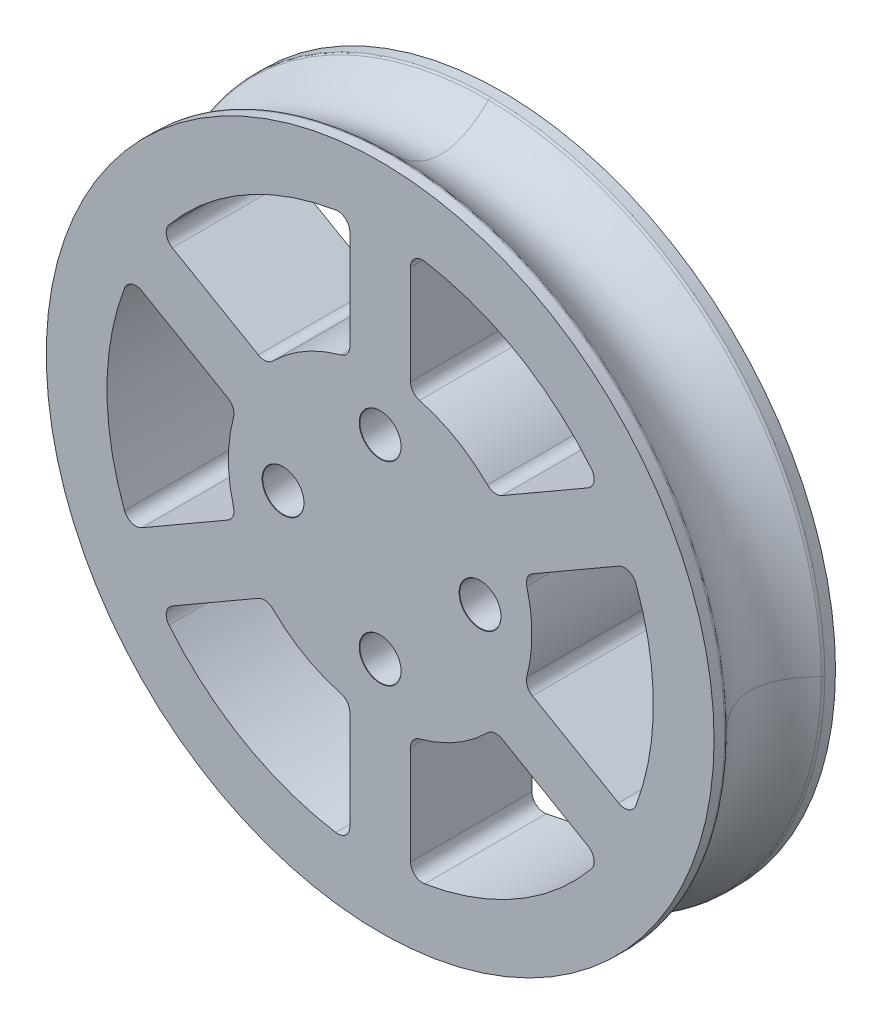
from build123d import *

# Parameters (mm, degrees)
SKETCH_1_R                  = 27.5
EXTRUDE_1_DEPTH             = 10
CUT_EXTRUDE_1_REACH         = 42.156
SKETCH_2_R                  = 22.5
SKETCH_3_R                  = 12.5
EXTRUDE_2_DEPTH             = 10
EXTRUDE_START               = 10
EXTRUDE_3_DEPTH             = 10
HOLE_WIZARD_M32_D           = 3.4
HOLE_WIZARD_M32_CSINK_D     = 3.45
HOLE_WIZARD_M32_CSINK_ANGLE = 90
FILLET_1_R                  = 1
FILLET_3_R                  = 0.3


with BuildPart() as part:
    # Эскиз1 → Бобышка-Вытянуть1 (new body)
    with BuildSketch(Plane.XY):
        Circle(SKETCH_1_R)
    extrude(amount=EXTRUDE_1_DEPTH)

    # Эскиз2 → Вырез-Вытянуть1 (cut, up to next)
    with BuildSketch(Plane.XY.offset(10), mode=Mode.PRIVATE) as cut_extrude_1_sk1:
        Circle(SKETCH_2_R)
    cut_extrude_1_tool1 = extrude(cut_extrude_1_sk1.sketch, amount=-CUT_EXTRUDE_1_REACH, mode=Mode.PRIVATE) & part.part
    add(cut_extrude_1_tool1.solids().sort_by_distance((0, 0, 10))[0], mode=Mode.SUBTRACT)



with BuildPart() as body_2:
    # Эскиз3 → Бобышка-Вытянуть2 (new body)
    with BuildSketch(Plane.XY):
        Circle(SKETCH_3_R)
    extrude(amount=EXTRUDE_2_DEPTH)


with BuildPart() as part_1:
    add(part.part)

    add(body_2.part)  # Бобышка-Вытянуть3 merges body 2
    # Эскиз5 → Бобышка-Вытянуть3 (add)
    with BuildSketch(Plane.XY.offset(EXTRUDE_START)):
        with BuildLine():
            Line((9.356601718, 8.288787866), (18.114916731, 13.345403397))
            ThreePointArc((18.114916731, 13.345403397), (19.485571585, 11.25), (20.614916731, 9.015276378))
            Line((20.614916731, 9.015276378), (11.856601718, 3.958660847))
            ThreePointArc((11.856601718, 3.958660847), (10.825317547, 6.25), (9.356601718, 8.288787866))
        make_face()
        with BuildLine():
            Line((2.5, 12.247448714), (2.5, 22.360679775))
            ThreePointArc((2.5, 22.360679775), (0, 22.5), (-2.5, 22.360679775))
            Line((-2.5, 22.360679775), (-2.5, 12.247448714))
            ThreePointArc((-2.5, 12.247448714), (0, 12.5), (2.5, 12.247448714))
        make_face()
        with BuildLine():
            Line((11.856601718, -3.958660847), (20.614916731, -9.015276378))
            ThreePointArc((20.614916731, -9.015276378), (19.485571585, -11.25), (18.114916731, -13.345403397))
            Line((18.114916731, -13.345403397), (9.356601718, -8.288787866))
            ThreePointArc((9.356601718, -8.288787866), (10.825317547, -6.25), (11.856601718, -3.958660847))
        make_face()
        with BuildLine():
            Line((2.5, -12.247448714), (2.5, -22.360679775))
            ThreePointArc((2.5, -22.360679775), (0, -22.5), (-2.5, -22.360679775))
            Line((-2.5, -22.360679775), (-2.5, -12.247448714))
            ThreePointArc((-2.5, -12.247448714), (0, -12.5), (2.5, -12.247448714))
        make_face()
        with BuildLine():
            Line((-9.356601718, -8.288787866), (-18.114916731, -13.345403397))
            ThreePointArc((-18.114916731, -13.345403397), (-19.485571585, -11.25), (-20.614916731, -9.015276378))
            Line((-20.614916731, -9.015276378), (-11.856601718, -3.958660847))
            ThreePointArc((-11.856601718, -3.958660847), (-10.825317547, -6.25), (-9.356601718, -8.288787866))
        make_face()
        with BuildLine():
            Line((-11.856601718, 3.958660847), (-20.614916731, 9.015276378))
            ThreePointArc((-20.614916731, 9.015276378), (-19.485571585, 11.25), (-18.114916731, 13.345403397))
            Line((-18.114916731, 13.345403397), (-9.356601718, 8.288787866))
            ThreePointArc((-9.356601718, 8.288787866), (-10.825317547, 6.25), (-11.856601718, 3.958660847))
        make_face()
    extrude(amount=-EXTRUDE_3_DEPTH)

    # Отверстие с зазором M32 (through all)
    with Locations(Plane.XY.offset(10)):
        with Locations((-8, 0), (0, 8), (8.225054206, 0), (0, -8)):
            CounterSinkHole(HOLE_WIZARD_M32_D / 2, HOLE_WIZARD_M32_CSINK_D / 2, counter_sink_angle=HOLE_WIZARD_M32_CSINK_ANGLE)

    # Скругление1
    fillet_1_edges = [part_1.edges().sort_by_distance(p)[0] for p in [
        (9.356601718, -8.288787866, 5),
        (2.5, -12.247448714, 5),
        (2.5, -22.360679775, 5),
        (18.114916731, -13.345403397, 5),
        (-9.356601718, -8.288787866, 5),
        (-2.5, -12.247448714, 5),
        (-2.5, -22.360679775, 5),
        (-18.114916731, -13.345403397, 5),
        (11.856601718, -3.958660847, 5),
        (20.614916731, -9.015276378, 5),
        (20.614916731, 9.015276378, 5),
        (11.856601718, 3.958660847, 5),
        (2.5, 12.247448714, 5),
        (2.5, 22.360679775, 5),
        (18.114916731, 13.345403397, 5),
        (9.356601718, 8.288787866, 5),
        (-2.5, 12.247448714, 5),
        (-2.5, 22.360679775, 5),
        (-18.114916731, 13.345403397, 5),
        (-9.356601718, 8.288787866, 5),
        (-20.614916731, 9.015276378, 5),
        (-11.856601718, -3.958660847, 5),
        (-11.856601718, 3.958660847, 5),
        (-20.614916731, -9.015276378, 5),
    ]]
    fillet(fillet_1_edges, radius=FILLET_1_R)

    # Вырез-По траектории2: sweep along a curve in space
    with BuildLine() as sweep_2_path:
        ThreePointArc((27.5, 0, 10), (19.445436483, 19.445436483, 10), (0, 27.5, 10))
        ThreePointArc((0, 27.5, 10), (-19.445436483, 19.445436483, 10), (-27.5, 0, 10))
        ThreePointArc((-27.5, 0, 10), (-19.445436483, -19.445436483, 10), (0, -27.5, 10))
        ThreePointArc((0, -27.5, 10), (19.445436483, -19.445436483, 10), (27.5, 0, 10))
    # Эскиз13 → Вырез-По траектории2 (sweep, cut)
    with BuildSketch(Plane(origin=(0, 0, 0), x_dir=(0, 0, -1), z_dir=(1, 0, 0))):
        with BuildLine():
            Line((-9, 27.5), (-1, 27.5))
            add(Edge.make_bspline(
                [(-9, 27.5), (-5, 23.5), (-1, 27.5)],
                knots=[0, 0, 0, 1, 1, 1], degree=2))
        make_face()
    sweep(path=sweep_2_path.line, mode=Mode.SUBTRACT)

    # Скругление3
    fillet_3_edges = [part_1.edges().sort_by_distance(p)[0] for p in [
        (19.445436483, 19.445436483, 9),
        (-19.445436483, -19.445436483, 9),
        (-19.445436483, -19.445436483, 1),
        (19.445436483, 19.445436483, 1),
    ]]
    fillet(fillet_3_edges, radius=FILLET_3_R)


solid = part_1.part
